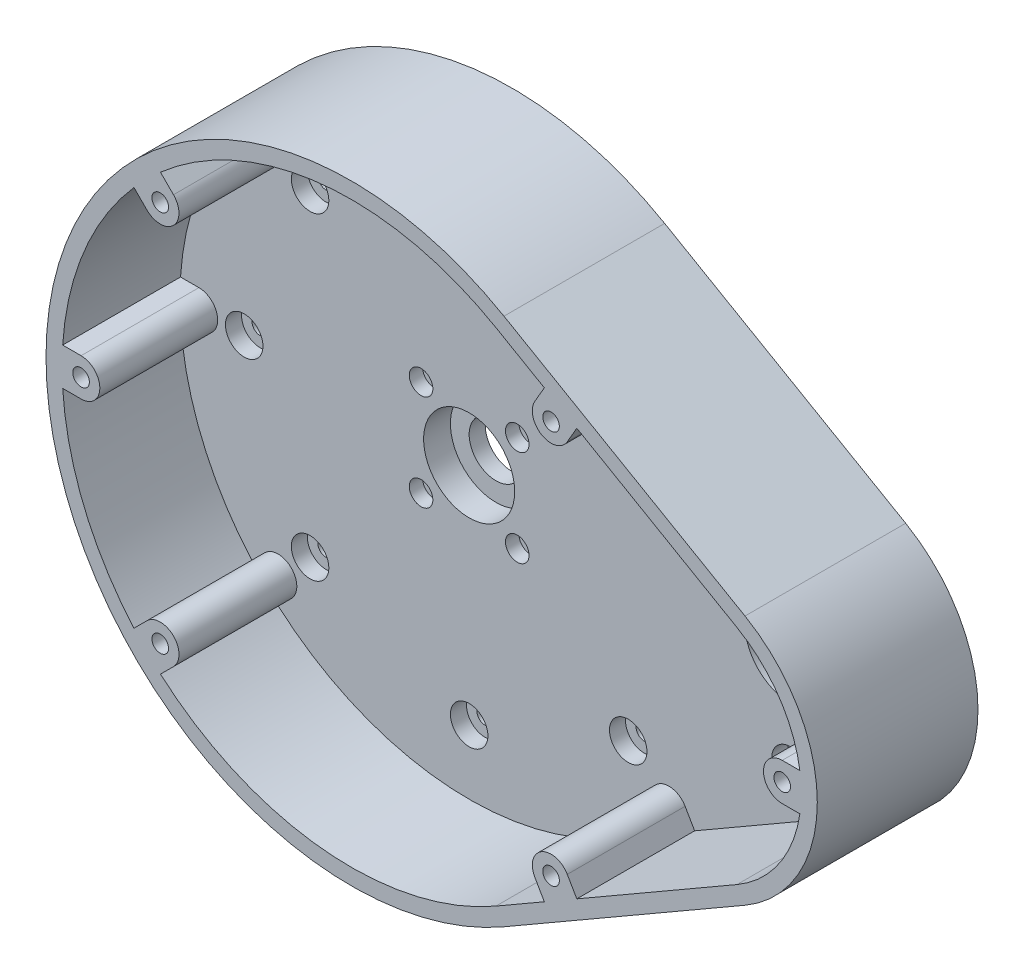
from build123d import *
from build123d.topology import SkipClean

# Parameters (mm, degrees)
BOSS_EXTRUDE1_DEPTH = 30
SKETCH3_R           = 1.55
CUT_EXTRUDE1_DEPTH  = 22
CUT_EXTRUDE2_START  = -30
SKETCH5_R           = 1.55
CUT_EXTRUDE2_DEPTH  = 30
CUT_EXTRUDE3_START  = -5
SKETCH6_R           = 3.5
CUT_EXTRUDE3_DEPTH  = 5
SKETCH7_R           = 8.5
CUT_EXTRUDE10_DEPTH = 5
SKETCH8_R           = 5
SKETCH8_R_2         = 1.05
CUT_EXTRUDE7_DEPTH  = 8
SKETCH9_R           = 2.2
CUT_EXTRUDE8_DEPTH  = 2.5
SKETCH11_R          = 1.55
CUT_EXTRUDE11_DEPTH = 8
SKETCH12_R          = 3.5
CUT_EXTRUDE12_DEPTH = 3


with BuildPart() as part:
    # Sketch1 → Boss-Extrude1 (new body)
    with BuildSketch(Plane.XY):
        with BuildLine():
            Line((-1.5, 49.363448016), (43.5, 23.382685902))
            ThreePointArc((43.5, 23.382685902), (57, 0), (43.5, -23.382685902))
            Line((43.5, -23.382685902), (-1.5, -49.363448016))
            ThreePointArc((-1.5, -49.363448016), (-87, 0), (-1.5, 49.363448016))
        make_face()
    extrude(amount=BOSS_EXTRUDE1_DEPTH)

    # Sketch3 → Cut-Extrude1 (cut)
    with BuildSketch(Plane.XY.offset(30)):
        with Locations((50.449984706, 0.025940866)):
            Circle(SKETCH3_R)
        with Locations((-80.45, 0)):
            Circle(SKETCH3_R)
        with Locations((-65.673537111, 35.673537111)):
            Circle(SKETCH3_R)
        with Locations((7.291641994, -36.724302618)):
            Circle(SKETCH3_R)
        with Locations((-65.673537111, -35.673537111)):
            Circle(SKETCH3_R)
        with Locations((7.291641994, 36.724302618)):
            Circle(SKETCH3_R)
        with BuildLine():
            Line((50.449984706, 3.525940866), (53.739581736, 3.525940866))
            ThreePointArc((53.739581736, 3.525940866), (49.844264614, 13.498339229), (42, 20.784609691))
            Line((42, 20.784609691), (12.097730907, 38.048692801))
            Line((12.097730907, 38.048692801), (10.322730907, 34.974302618))
            ThreePointArc((10.322730907, 34.974302618), (5.541641994, 33.693213704), (4.26055308, 38.474302618))
            Line((4.26055308, 38.474302618), (6.03555308, 41.548692801))
            Line((6.03555308, 41.548692801), (-3, 46.765371804))
            ThreePointArc((-3, 46.765371804), (-35.308766962, 53.738412643), (-65.628603797, 40.578351266))
            Line((-65.628603797, 40.578351266), (-63.198663377, 38.148410845))
            ThreePointArc((-63.198663377, 38.148410845), (-63.198663377, 33.198663377), (-68.148410845, 33.198663377))
            Line((-68.148410845, 33.198663377), (-70.578351266, 35.628603797))
            ThreePointArc((-70.578351266, 35.628603797), (-79.889494756, 20.664905348), (-83.886454699, 3.5))
            Line((-83.886454699, 3.5), (-80.45, 3.5))
            ThreePointArc((-80.45, 3.5), (-76.95, 0), (-80.45, -3.5))
            Line((-80.45, -3.5), (-83.886454699, -3.5))
            ThreePointArc((-83.886454699, -3.5), (-79.889494756, -20.664905348), (-70.578351266, -35.628603797))
            Line((-70.578351266, -35.628603797), (-68.148410845, -33.198663377))
            ThreePointArc((-68.148410845, -33.198663377), (-63.198663377, -33.198663377), (-63.198663377, -38.148410845))
            Line((-63.198663377, -38.148410845), (-65.628603797, -40.578351266))
            ThreePointArc((-65.628603797, -40.578351266), (-35.308766962, -53.738412643), (-3, -46.765371804))
            Line((-3, -46.765371804), (6.035553081, -41.548692801))
            Line((6.035553081, -41.548692801), (4.260553081, -38.474302618))
            ThreePointArc((4.260553081, -38.474302618), (5.541641994, -33.693213705), (10.322730907, -34.974302618))
            Line((10.322730907, -34.974302618), (12.097730907, -38.048692801))
            Line((12.097730907, -38.048692801), (42, -20.784609691))
            ThreePointArc((42, -20.784609691), (49.859000377, -13.476650327), (53.747229589, -3.474059134))
            Line((53.747229589, -3.474059134), (50.449984706, -3.474059134))
            ThreePointArc((50.449984706, -3.474059134), (46.949984706, 0.025940866), (50.449984706, 3.525940866))
        make_face()
    extrude(amount=-CUT_EXTRUDE1_DEPTH, mode=Mode.SUBTRACT)

    # Sketch5 → Cut-Extrude2 (cut)
    with SkipClean():  # the faces are left unmerged after this step: merging them gives an invalid solid
        with BuildSketch(Plane(origin=(0, 0, 0), x_dir=(-1, 0, 0), z_dir=(0, 0, -1)).offset(CUT_EXTRUDE2_START)):
            with Locations((65.673537111, 35.673537111)):
                Circle(SKETCH5_R)
            with Locations((80.45, 0)):
                Circle(SKETCH5_R)
            with Locations((-50.449984706, 0.025940866)):
                Circle(SKETCH5_R)
            with Locations((-7.291641994, -36.724302618)):
                Circle(SKETCH5_R)
            with Locations((65.673537111, -35.673537111)):
                Circle(SKETCH5_R)
            with Locations((-7.291641994, 36.724302618)):
                Circle(SKETCH5_R)
        extrude(amount=CUT_EXTRUDE2_DEPTH, mode=Mode.SUBTRACT)

    # Sketch6 → Cut-Extrude3 (cut)
    with SkipClean():  # the faces are left unmerged after this step: merging them gives an invalid solid
        with BuildSketch(Plane(origin=(0, 0, 0), x_dir=(-1, 0, 0), z_dir=(0, 0, -1)).offset(CUT_EXTRUDE3_START)):
            with Locations((-50.449984706, 0.025940866)):
                Circle(SKETCH6_R)
            with Locations((-7.291641994, -36.724302618)):
                Circle(SKETCH6_R)
            with Locations((80.45, 0)):
                Circle(SKETCH6_R)
            with Locations((65.673537111, 35.673537111)):
                Circle(SKETCH6_R)
            with Locations((65.673537111, -35.673537111)):
                Circle(SKETCH6_R)
            with Locations((-7.291641994, 36.724302618)):
                Circle(SKETCH6_R)
        extrude(amount=CUT_EXTRUDE3_DEPTH, mode=Mode.SUBTRACT)

    # Sketch7 → Cut-Extrude10 (cut)
    with SkipClean():  # the faces are left unmerged after this step: merging them gives an invalid solid
        with BuildSketch(Plane.XY.offset(8)):
            with Locations((-30, 0)):
                Circle(SKETCH7_R)
            with Locations((30, 0)):
                Circle(SKETCH7_R)
        extrude(amount=-CUT_EXTRUDE10_DEPTH, mode=Mode.SUBTRACT)

    # Sketch8 → Cut-Extrude7 (cut)
    with SkipClean():  # the faces are left unmerged after this step: merging them gives an invalid solid
        with BuildSketch(Plane.XY.offset(8)):
            with Locations((-30, 0)):
                Circle(SKETCH8_R)
            with Locations((-38.980256121, 8.980256121)):
                Circle(SKETCH8_R_2)
            with Locations((-21.019743879, 8.980256121)):
                Circle(SKETCH8_R_2)
            with Locations((-21.019743879, -8.980256121)):
                Circle(SKETCH8_R_2)
            with Locations((-38.980256121, -8.980256121)):
                Circle(SKETCH8_R_2)
        extrude(amount=-CUT_EXTRUDE7_DEPTH, mode=Mode.SUBTRACT)

    # Sketch9 → Cut-Extrude8 (cut)
    with SkipClean():  # the faces are left unmerged after this step: merging them gives an invalid solid
        with BuildSketch(Plane.XY.offset(8)):
            with Locations((-38.980256121, 8.980256121)):
                Circle(SKETCH9_R)
            with Locations((-21.019743879, 8.980256121)):
                Circle(SKETCH9_R)
            with Locations((-21.019743879, -8.980256121)):
                Circle(SKETCH9_R)
            with Locations((-38.980256121, -8.980256121)):
                Circle(SKETCH9_R)
        extrude(amount=-CUT_EXTRUDE8_DEPTH, mode=Mode.SUBTRACT)

    # Sketch11 → Cut-Extrude11 (cut)
    with SkipClean():  # the faces are left unmerged after this step: merging them gives an invalid solid
        with BuildSketch(Plane.XY.offset(8)):
            with Locations((-0.30151519, 29.69848481)):
                Circle(SKETCH11_R)
            with Locations((-30, 42)):
                Circle(SKETCH11_R)
            with Locations((-59.69848481, 29.69848481)):
                Circle(SKETCH11_R)
            with Locations((-72, 0)):
                Circle(SKETCH11_R)
            with Locations((-59.69848481, -29.69848481)):
                Circle(SKETCH11_R)
            with Locations((-30, -42)):
                Circle(SKETCH11_R)
            with Locations((-0.30151519, -29.69848481)):
                Circle(SKETCH11_R)
            with Locations((30, 19)):
                Circle(SKETCH11_R)
            with Locations((30, -19)):
                Circle(SKETCH11_R)
        extrude(amount=-CUT_EXTRUDE11_DEPTH, mode=Mode.SUBTRACT)

    # Sketch12 → Cut-Extrude12 (cut)
    with SkipClean():  # the faces are left unmerged after this step: merging them gives an invalid solid
        with BuildSketch(Plane.XY.offset(8)):
            with Locations((-0.30151519, 29.69848481)):
                Circle(SKETCH12_R)
            with Locations((-30, 42)):
                Circle(SKETCH12_R)
            with Locations((-59.69848481, 29.69848481)):
                Circle(SKETCH12_R)
            with Locations((-72, 0)):
                Circle(SKETCH12_R)
            with Locations((-59.69848481, -29.69848481)):
                Circle(SKETCH12_R)
            with Locations((-30, -42)):
                Circle(SKETCH12_R)
            with Locations((-0.30151519, -29.69848481)):
                Circle(SKETCH12_R)
            with Locations((30, 19)):
                Circle(SKETCH12_R)
            with Locations((30, -19)):
                Circle(SKETCH12_R)
        extrude(amount=-CUT_EXTRUDE12_DEPTH, mode=Mode.SUBTRACT)


solid = part.part
